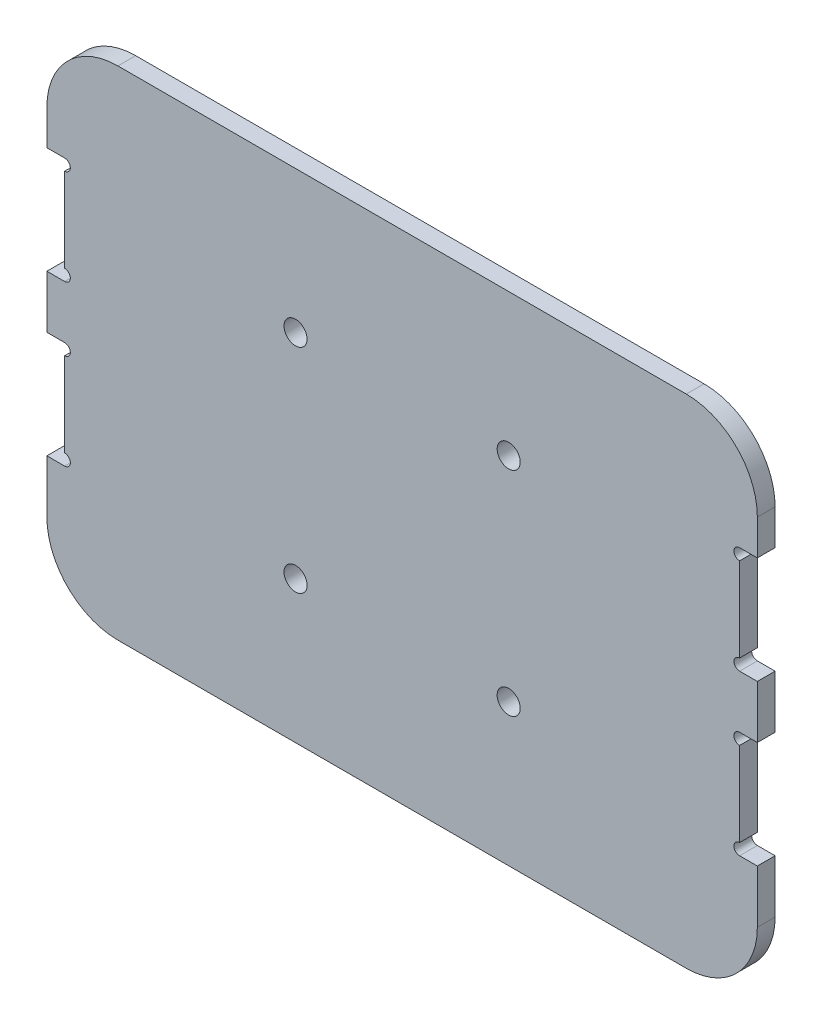
from build123d import *

# Parameters (mm, degrees)
SKETCH_1_W          = 200
SKETCH_1_H          = 140
SKETCH_1_R          = 3.25
EXTRUDE_1_DEPTH     = 5
FILLET_1_R          = 20
SKETCH_3_W          = 5
SKETCH_3_H          = 30
CUT_EXTRUDE_1_DEPTH = 39
SKETCH_4_R          = 1.55
CUT_EXTRUDE_2_DEPTH = 10
MOVE_FACE_1_BY      = 0.05
MOVE_FACE_1_2_BY    = 0.05
MOVE_FACE_1_3_BY    = 0.05
MOVE_FACE_1_4_BY    = 0.05
MOVE_FACE_1_5_BY    = 0.05
MOVE_FACE_1_6_BY    = 0.05
MOVE_FACE_1_7_BY    = 0.05
MOVE_FACE_1_8_BY    = 0.05
MOVE_FACE_1_9_BY    = 0.05
MOVE_FACE_1_10_BY   = 0.05
MOVE_FACE_1_11_BY   = 0.05
MOVE_FACE_1_12_BY   = 0.05
MOVE_FACE_1_13_BY   = 0.05
MOVE_FACE_1_14_BY   = 0.05
MOVE_FACE_1_15_BY   = 0.05
MOVE_FACE_1_16_BY   = 0.05


with BuildPart() as part:
    # 草图1 → 凸台-拉伸1 (new body)
    with BuildSketch(Plane.XY):
        with Locations((0, 50)):
            Rectangle(SKETCH_1_W, SKETCH_1_H)
        with Locations((30, 80)):
            Circle(SKETCH_1_R, mode=Mode.SUBTRACT)
        with Locations((30, 20)):
            Circle(SKETCH_1_R, mode=Mode.SUBTRACT)
        with Locations((-30, 80)):
            Circle(SKETCH_1_R, mode=Mode.SUBTRACT)
        with Locations((-30, 20)):
            Circle(SKETCH_1_R, mode=Mode.SUBTRACT)
    extrude(amount=EXTRUDE_1_DEPTH)

    # 圆角1
    fillet_1_edges = [part.edges().sort_by_distance(p)[0] for p in [
        (-100, 120, 2.5),
        (-100, -20, 2.5),
        (100, -20, 2.5),
        (100, 120, 2.5),
    ]]
    fillet(fillet_1_edges, radius=FILLET_1_R)

    # 草图3 → 切除-拉伸1 (cut)
    with BuildSketch(Plane.XY.offset(5)):
        with Locations((97.5, 75)):
            Rectangle(SKETCH_3_W, SKETCH_3_H)
        with Locations((97.5, 30)):
            Rectangle(SKETCH_3_W, SKETCH_3_H)
        with Locations((-97.5, 30)):
            Rectangle(SKETCH_3_W, SKETCH_3_H)
        with Locations((-97.5, 75)):
            Rectangle(SKETCH_3_W, SKETCH_3_H)
    extrude(amount=-CUT_EXTRUDE_1_DEPTH, mode=Mode.SUBTRACT)

    # 草图4 → 切除-拉伸2 (cut)
    with BuildSketch(Plane.XY.offset(5)):
        with Locations((95, 88.45)):
            Circle(SKETCH_4_R)
        with Locations((95, 61.55)):
            Circle(SKETCH_4_R)
        with Locations((95, 43.45)):
            Circle(SKETCH_4_R)
        with Locations((95, 16.55)):
            Circle(SKETCH_4_R)
        with Locations((-95, 16.55)):
            Circle(SKETCH_4_R)
        with Locations((-95, 43.45)):
            Circle(SKETCH_4_R)
        with Locations((-95, 61.55)):
            Circle(SKETCH_4_R)
        with Locations((-95, 88.45)):
            Circle(SKETCH_4_R)
    extrude(amount=-CUT_EXTRUDE_2_DEPTH, mode=Mode.SUBTRACT)

    # Move Face 1: a face moved inward by 0.05
    extrude(part.faces().sort_by_distance((-97.5, 90, 2.5))[0], amount=MOVE_FACE_1_BY, dir=(0, 1, 0), mode=Mode.SUBTRACT)

    # Move Face 1 2: a curved face moved inward by 0.05
    add(Solid.thicken(part.faces().sort_by_distance((-93.45, 88.45, 2.5))[0], -MOVE_FACE_1_2_BY), mode=Mode.SUBTRACT)

    # Move Face 1 3: a curved face moved inward by 0.05
    add(Solid.thicken(part.faces().sort_by_distance((-93.45, 61.55, 2.5))[0], -MOVE_FACE_1_3_BY), mode=Mode.SUBTRACT)

    # Move Face 1 4: a face moved inward by 0.05
    extrude(part.faces().sort_by_distance((-97.5, 60, 2.5))[0], amount=MOVE_FACE_1_4_BY, dir=(0, -1, 0), mode=Mode.SUBTRACT)

    # Move Face 1 5: a face moved inward by 0.05
    extrude(part.faces().sort_by_distance((-97.5, 45, 2.5))[0], amount=MOVE_FACE_1_5_BY, dir=(0, 1, 0), mode=Mode.SUBTRACT)

    # Move Face 1 6: a curved face moved inward by 0.05
    add(Solid.thicken(part.faces().sort_by_distance((-93.45, 43.45, 2.5))[0], -MOVE_FACE_1_6_BY), mode=Mode.SUBTRACT)

    # Move Face 1 7: a curved face moved inward by 0.05
    add(Solid.thicken(part.faces().sort_by_distance((-93.45, 16.55, 2.5))[0], -MOVE_FACE_1_7_BY), mode=Mode.SUBTRACT)

    # Move Face 1 8: a face moved inward by 0.05
    extrude(part.faces().sort_by_distance((-97.5, 15, 2.5))[0], amount=MOVE_FACE_1_8_BY, dir=(0, -1, 0), mode=Mode.SUBTRACT)

    # Move Face 1 9: a curved face moved inward by 0.05
    add(Solid.thicken(part.faces().sort_by_distance((93.45, 16.55, 2.5))[0], -MOVE_FACE_1_9_BY), mode=Mode.SUBTRACT)

    # Move Face 1 10: a face moved inward by 0.05
    extrude(part.faces().sort_by_distance((97.5, 15, 2.5))[0], amount=MOVE_FACE_1_10_BY, dir=(0, -1, 0), mode=Mode.SUBTRACT)

    # Move Face 1 11: a curved face moved inward by 0.05
    add(Solid.thicken(part.faces().sort_by_distance((93.45, 43.45, 2.5))[0], -MOVE_FACE_1_11_BY), mode=Mode.SUBTRACT)

    # Move Face 1 12: a face moved inward by 0.05
    extrude(part.faces().sort_by_distance((97.5, 45, 2.5))[0], amount=MOVE_FACE_1_12_BY, dir=(0, 1, 0), mode=Mode.SUBTRACT)

    # Move Face 1 13: a face moved inward by 0.05
    extrude(part.faces().sort_by_distance((97.5, 60, 2.5))[0], amount=MOVE_FACE_1_13_BY, dir=(0, -1, 0), mode=Mode.SUBTRACT)

    # Move Face 1 14: a curved face moved inward by 0.05
    add(Solid.thicken(part.faces().sort_by_distance((93.45, 61.55, 2.5))[0], -MOVE_FACE_1_14_BY), mode=Mode.SUBTRACT)

    # Move Face 1 15: a curved face moved inward by 0.05
    add(Solid.thicken(part.faces().sort_by_distance((93.45, 88.45, 2.5))[0], -MOVE_FACE_1_15_BY), mode=Mode.SUBTRACT)

    # Move Face 1 16: a face moved inward by 0.05
    extrude(part.faces().sort_by_distance((97.5, 90, 2.5))[0], amount=MOVE_FACE_1_16_BY, dir=(0, 1, 0), mode=Mode.SUBTRACT)


solid = part.part
